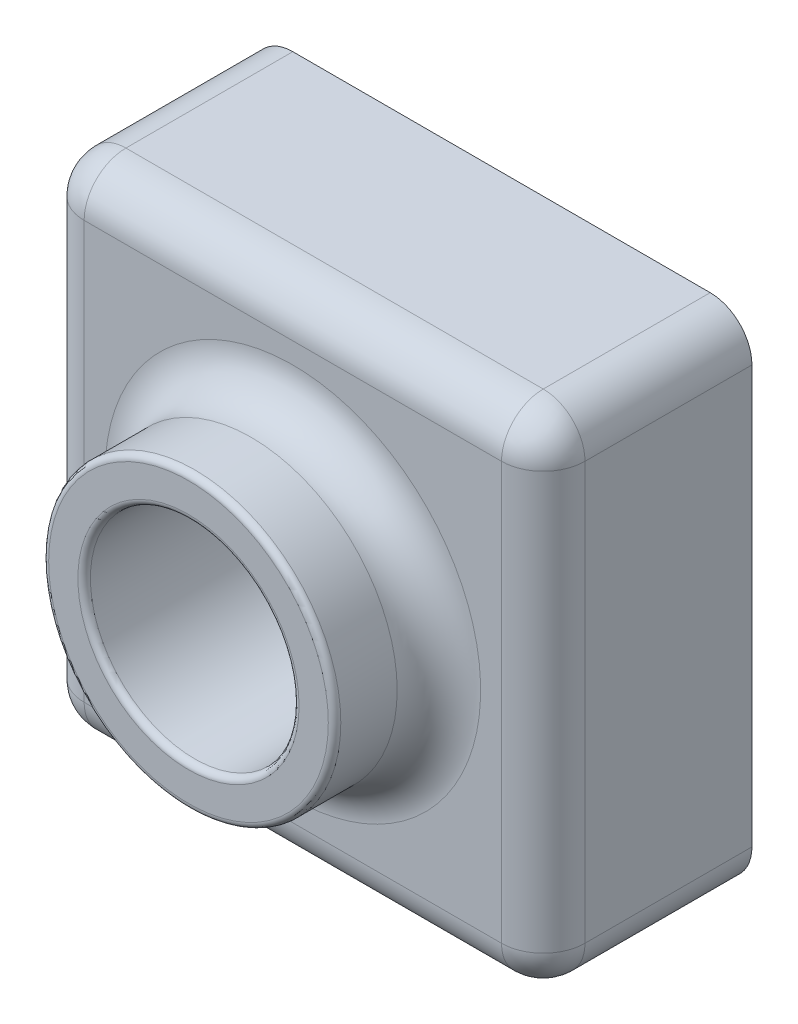
from build123d import *

# Parameters (mm, degrees)
SKETCH1_W           = 120
SKETCH1_H           = 120
BOSS_EXTRUDE2_DEPTH = 50
SKETCH3_R           = 35
BOSS_EXTRUDE3_DEPTH = 25
SKETCH4_R           = 25
CUT_EXTRUDE2_DEPTH  = 186.539753153
FILLET4_R           = 10
FILLET5_R           = 1.5
SHELL2_T            = -2


with BuildPart() as part:
    # Sketch1 → Boss-Extrude2 (new body)
    with BuildSketch(Plane.XY):
        with Locations((60, 60)):
            Rectangle(SKETCH1_W, SKETCH1_H)
    extrude(amount=BOSS_EXTRUDE2_DEPTH)

    # Sketch3 → Boss-Extrude3 (add)
    with BuildSketch(Plane.XY.offset(50)):
        with Locations((60, 60)):
            Circle(SKETCH3_R)
    extrude(amount=BOSS_EXTRUDE3_DEPTH)

    # Sketch4 → Cut-Extrude2 (cut, through all)
    with BuildSketch(Plane.XY.offset(75)):
        with Locations((60, 60)):
            Circle(SKETCH4_R)
    extrude(amount=-CUT_EXTRUDE2_DEPTH, mode=Mode.SUBTRACT)

    # Fillet4
    fillet4_edges = [part.edges().sort_by_distance(p)[0] for p in [
        (60, 120, 50),
        (120, 60, 50),
        (60, 0, 50),
        (0, 60, 50),
        (25, 60, 50),
        (0, 0, 25),
        (0, 120, 25),
        (120, 120, 25),
        (120, 0, 25),
    ]]
    fillet(fillet4_edges, radius=FILLET4_R)

    # Fillet5
    fillet5_edges = [part.edges().sort_by_distance(p)[0] for p in [
        (25, 60, 75),
        (35, 60, 75),
    ]]
    fillet(fillet5_edges, radius=FILLET5_R)

    # Shell2
    shell2_openings = [part.faces().sort_by_distance(p)[0] for p in [
        (60, 1.697056275, 0),
    ]]
    offset(amount=SHELL2_T, openings=shell2_openings, kind=Kind.INTERSECTION)


solid = part.part
